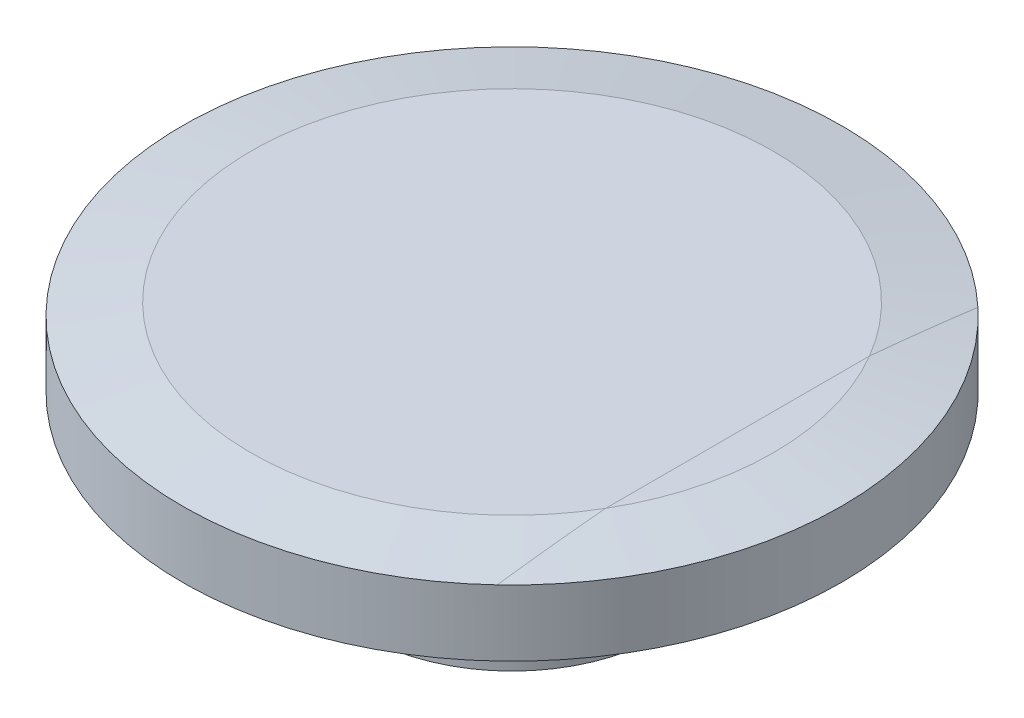
from build123d import *
from build123d.topology import SkipClean

# Parameters (mm, degrees)
CHAMFER2_SIZE           = 1
CHAMFER2_SIZE2          = 8.144346428
CUT_EXTRUDE1_DEPTH      = 28.792265111
CUT_EXTRUDE1_DEPTH_BACK = 5
CHAMFER1_SIZE           = 1
CHAMFER3_SIZE           = 0.5
CHAMFER3_SIZE2          = 0.288675135
SKETCH6_R               = 8.6
SKETCH6_R_2             = 5.6
BOSS_EXTRUDE1_DEPTH     = 10.25
CUT_EXTRUDE3_START      = 5
SKETCH7_R               = 3
CUT_EXTRUDE3_DEPTH      = 5
SHELL6_2_OUTLINE_W      = 7.15
SHELL6_2_OUTLINE_H      = 0.3
SKETCH9_R               = 9.15
SKETCH9_R_2             = 7.15
BOSS_EXTRUDE3_DEPTH     = 0.35


with BuildPart() as part:
    # Sketch1 → Revolve1 (revolve)
    with BuildSketch(Plane.XY, mode=Mode.PRIVATE) as revolve1_sk:
        Polygon((-15.060768988, 5.5), (-19, 4.805407289), (-19, 0), (-10.35, 0), (-10.35, -0.35), (-8.6, -0.35), (-8.6, -6.85), (-5.6, -6.85), (-5.6, 3.4), (-3, 3.4), (-3, -1.6), (0, -1.6), (0, 5.5), align=None)
    revolve(revolve1_sk.sketch.rotate(Axis((0, -1.6, 0), (0, 1, 0)), 180), axis=Axis((0, -1.6, 0), (0, 1, 0)))

    # Chamfer2
    chamfer2_edges = [part.edges().sort_by_distance(p)[0] for p in [
        (-19, 0, 0),
    ]]
    chamfer2_side = [part.faces().sort_by_distance(p)[0] for p in [
        (-19, 2.402703645, 0),
    ]]
    chamfer(chamfer2_edges, length=CHAMFER2_SIZE, length2=CHAMFER2_SIZE2, reference=chamfer2_side[0])

    # Sketch2 → Cut-Extrude1 (cut, two sides: drawn at the far end of the back side and taken through both)
    with BuildSketch(Plane.XZ.offset(1.6).offset(-CUT_EXTRUDE1_DEPTH_BACK)):
        Polygon((-5.85, 1.85), (-6.6, 1.1), (-6.6, -1.1), (-5.85, -1.85), (-0.35, -1.85), (0.4, -1.1), (0.4, 1.1), (-0.35, 1.85), align=None)
    extrude(amount=CUT_EXTRUDE1_DEPTH + CUT_EXTRUDE1_DEPTH_BACK, mode=Mode.SUBTRACT)

    # Chamfer1
    chamfer1_edges = [part.edges().sort_by_distance(p)[0] for p in [
        (5.6, -6.85, 0),
    ]]
    chamfer(chamfer1_edges, length=CHAMFER1_SIZE)

    # Chamfer3
    chamfer3_edges = [part.edges().sort_by_distance(p)[0] for p in [
        (-8.6, -6.85, 0),
    ]]
    chamfer3_side = [part.faces().sort_by_distance(p)[0] for p in [
        (-8.6, -3.6, 0),
    ]]
    chamfer(chamfer3_edges, length=CHAMFER3_SIZE, length2=CHAMFER3_SIZE2, reference=chamfer3_side[0])

    # Sketch6 → Boss-Extrude1 (add)
    with SkipClean():  # the faces are left unmerged after this step: merging them gives an invalid solid
        with BuildSketch(Plane.XZ.offset(-3.4)):
            Circle(SKETCH6_R)
            Circle(SKETCH6_R_2, mode=Mode.SUBTRACT)
        extrude(amount=BOSS_EXTRUDE1_DEPTH)

    # Sketch7 → Cut-Extrude3 (cut)
    with SkipClean():  # the faces are left unmerged after this step: merging them gives an invalid solid
        with BuildSketch(Plane.XZ.offset(-3.4).offset(CUT_EXTRUDE3_START)):
            Circle(SKETCH7_R)
        extrude(amount=-CUT_EXTRUDE3_DEPTH, mode=Mode.SUBTRACT)


with BuildPart() as body_2:
    # Split1: the piece on the far side of the plane
    add(part.part)
    split(bisect_by=Plane(origin=(0, 4.3, 0), x_dir=(1, 0, 0), z_dir=(0, 1, 0)), keep=Keep.BOTTOM)

    # Shell6: read off the stored shape, not the designer's step
    # Shell6 outline → Shell6 (revolve, cut)
    with SkipClean():  # the faces are left unmerged after this step: merging them gives an invalid solid
        with BuildSketch(Plane.XY):
            Polygon((7.15, 4.3), (7.15, 0.85), (9.15, 0.85), (9.15, 1.2), (10.782258428, 1.2), (17.8, 2.061670317), (17.8, 4.3), align=None)
        revolve(axis=Axis((0, 0, 0), (0, 1, 0)), mode=Mode.SUBTRACT)

    # Shell6 2 outline → Shell6 2 (revolve)
    with SkipClean():  # the faces are left unmerged after this step: merging them gives an invalid solid
        with BuildSketch(Plane.XY):
            with Locations((3.575, 4.45)):
                Rectangle(SHELL6_2_OUTLINE_W, SHELL6_2_OUTLINE_H)
        revolve(axis=Axis((0, 0, 0), (0, 1, 0)))

    # Sketch9 → Boss-Extrude3 (add)
    with SkipClean():  # the faces are left unmerged after this step: merging them gives an invalid solid
        with BuildSketch(Plane(origin=(0, 0.85, 0), x_dir=(1, 0, 0), z_dir=(0, 1, 0))):
            Circle(SKETCH9_R)
            Circle(SKETCH9_R_2, mode=Mode.SUBTRACT)
        extrude(amount=BOSS_EXTRUDE3_DEPTH)


with BuildPart() as part_1:
    add(part.part)

    # Split1
    split(bisect_by=Plane(origin=(0, 4.3, 0), x_dir=(1, 0, 0), z_dir=(0, 1, 0)), keep=Keep.TOP)


with BuildPart() as body_3:
    # Intersect1: read off the stored shape, not the designer's step
    # Intersect1 outline → Intersect1 (revolve)
    with BuildSketch(Plane.XY):
        Polygon((17.8, 4.3), (7.15, 4.3), (7.15, 1.2), (10.782258428, 1.2), (17.8, 2.061670317), align=None)
    revolve(axis=Axis((0, 0, 0), (0, 1, 0)))


with BuildPart() as body_4:
    # Intersect1 2 outline → Intersect1 2 (revolve)
    with BuildSketch(Plane.XY):
        Polygon((7.15, 4.6), (7.15, 4.3), (19, 4.3), (19, 4.805407289), (15.060768988, 5.5), (0, 5.5), (0, 4.6), align=None)
    revolve(axis=Axis((0, 0, 0), (0, 1, 0)))

    # Combine1: union body 2
    add(body_2.part)


solid = Compound([body_3.part, body_4.part])
